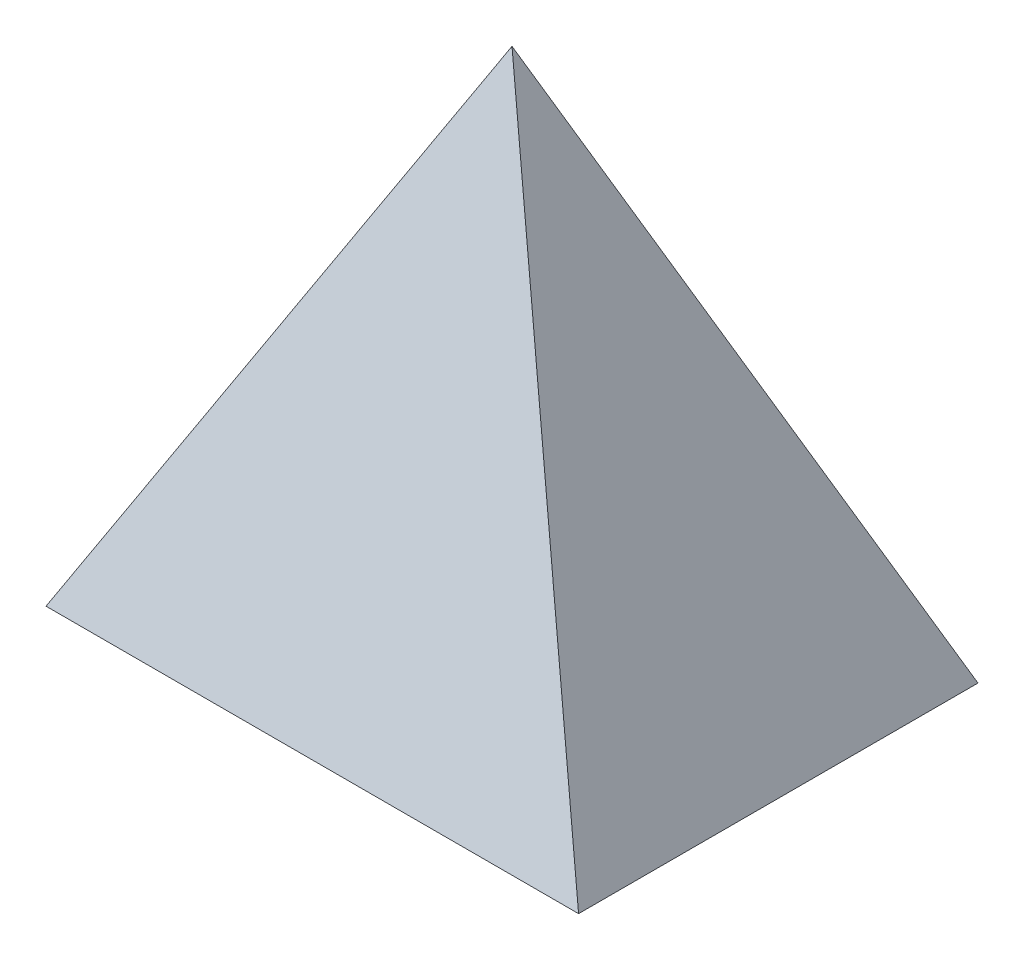
from build123d import *

# Parameters (mm, degrees)
BOSS_EXTRUDE6_DEPTH     = 114.3
CUT_EXTRUDE1_DEPTH      = 353.455997707
CUT_EXTRUDE1_DEPTH_BACK = 353.455997707


with BuildPart() as part:
    # Sketch5 → Boss-Extrude6 (new, symmetric)
    with BuildSketch(Plane.XY):
        Polygon((0, 0), (-152.4, -296.538328585), (152.4, -296.538328585), align=None)
    extrude(amount=BOSS_EXTRUDE6_DEPTH, both=True)

    # Sketch8 → Cut-Extrude1 (cut, two sides: drawn at the far end of the back side and taken through both)
    with BuildSketch(Plane(origin=(0, 0, 0), x_dir=(0, 0, -1), z_dir=(1, 0, 0)).offset(-CUT_EXTRUDE1_DEPTH_BACK)):
        Polygon((114.3, 0), (0, 0), (114.3, -296.538328585), align=None)
        Polygon((-114.3, -296.538328585), (0, 0), (-114.3, 0), align=None)
    extrude(amount=CUT_EXTRUDE1_DEPTH + CUT_EXTRUDE1_DEPTH_BACK, mode=Mode.SUBTRACT)


solid = part.part
